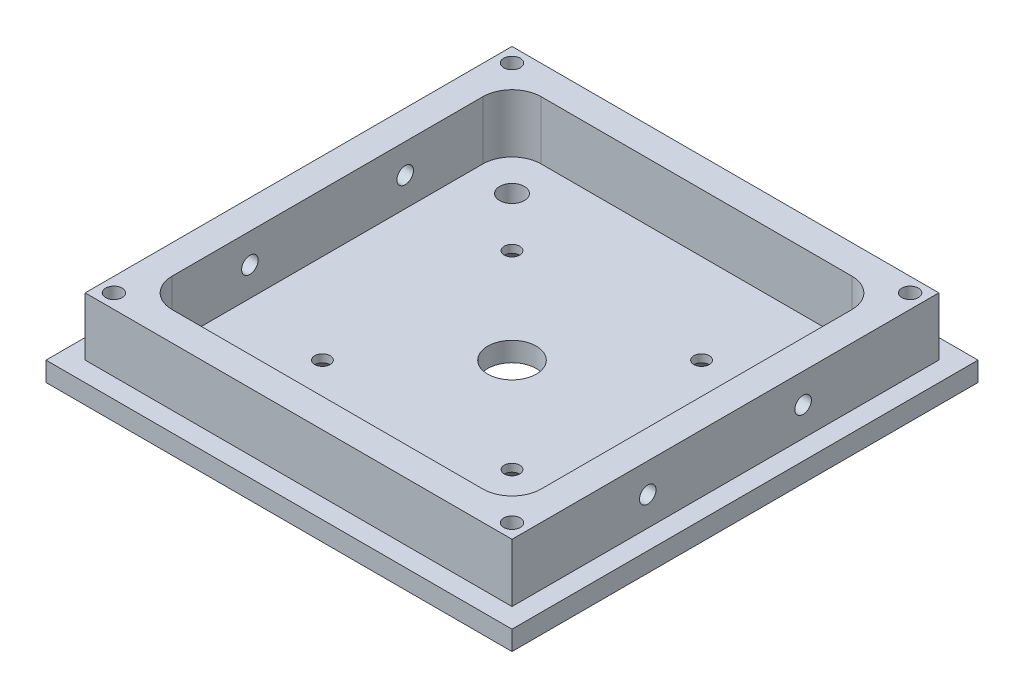
from build123d import *
from OCP.BRepFilletAPI import BRepFilletAPI_MakeChamfer

# Parameters (mm, degrees)
SKETCH1_W                    = 76.2
SKETCH1_H                    = 76.2
BOSS_EXTRUDE1_DEPTH          = 3.175
SKETCH2_W                    = 69.79412
SKETCH2_H                    = 69.79412
SKETCH2_W_2                  = 60.325
SKETCH2_H_2                  = 60.325
BOSS_EXTRUDE2_DEPTH          = 9.525
FILLET1_R                    = 4.7625
F_39_0_0995_DIAMETER_HOLE1_D = 2.5273
F_10_32_TAPPED_HOLE1_D       = 4.0386
CHAMFER1_SIZE                = 1.905
CHAMFER1_SIZE2               = 1.655991236
F_6_32_TAPPED_HOLE1_D        = 2.7051
SKETCH3_R                    = 3.96875
CUT_EXTRUDE1_DEPTH           = 55.716959208
CIRPATTERN1_COUNT            = 4


with BuildPart() as part:
    # Sketch1 → Boss-Extrude1 (new body)
    with BuildSketch(Plane(origin=(0, 0, 0), x_dir=(1, 0, 0), z_dir=(0, 1, 0))):
        Rectangle(SKETCH1_W, SKETCH1_H)
    extrude(amount=BOSS_EXTRUDE1_DEPTH)

    # Sketch2 → Boss-Extrude2 (add)
    with BuildSketch(Plane(origin=(0, 3.175, 0), x_dir=(1, 0, 0), z_dir=(0, 1, 0))):
        Rectangle(SKETCH2_W, SKETCH2_H)
        Rectangle(SKETCH2_W_2, SKETCH2_H_2, mode=Mode.SUBTRACT)
    extrude(amount=BOSS_EXTRUDE2_DEPTH)

    # Fillet1
    fillet1_edges = [part.edges().sort_by_distance(p)[0] for p in [
        (-30.1625, 7.9375, 30.1625),
        (30.1625, 7.9375, 30.1625),
        (30.1625, 7.9375, -30.1625),
        (-30.1625, 7.9375, -30.1625),
    ]]
    fillet(fillet1_edges, radius=FILLET1_R)

    # #39 (0.0995) Diameter Hole1 (through all)
    with Locations(Plane(origin=(0, 3.175, 0), x_dir=(1, 0, 0), z_dir=(0, 1, 0))):
        with Locations((15.5, 15.5), (-15.5, 15.5), (-15.5, -15.5), (15.5, -15.5), (-23.5966, 23.5966), (23.5966, 23.5966), (23.5966, -23.5966), (-23.5966, -23.5966)):
            Hole(F_39_0_0995_DIAMETER_HOLE1_D / 2)

    # #10-32 Tapped Hole1 (through all)
    with Locations(Plane(origin=(0, 3.175, 0), x_dir=(1, 0, 0), z_dir=(0, 1, 0))):
        with Locations((-23.5966, 23.5966), (23.5966, 23.5966), (23.5966, -23.5966), (-23.5966, -23.5966)):
            Hole(F_10_32_TAPPED_HOLE1_D / 2)

    # Sketch9 → #6-32 Tapped Hole2 (revolve, cut)
    with BuildSketch(Plane(origin=(34.89706, 7.9375, 12.7), x_dir=(0, 0, -1), z_dir=(0, 1, 0))):
        Polygon((0, 0), (0, 11.98869403), (1.35255, 11.176), (1.35255, 0), align=None)
    f_6_32_tapped_hole2 = revolve(axis=Axis((41.24706, 7.9375, 12.7), (-1, 0, 0)), mode=Mode.SUBTRACT)

    # Mirror1: #6-32 Tapped Hole2 across plane
    add(f_6_32_tapped_hole2.mirror(Plane.XY), mode=Mode.SUBTRACT)

    # Mirror2 copy 1 sketch → Mirror2 copy 1 (revolve, cut)
    with BuildSketch(Plane(origin=(-34.89706, 7.9375, -12.7), x_dir=(0, 0, 1), z_dir=(0, 1, 0))):
        Polygon((0, 0), (0, 11.98869403), (1.35255, 11.176), (1.35255, 0), align=None)
    revolve(axis=Axis((-41.24706, 7.9375, -12.7), (1, 0, 0)), mode=Mode.SUBTRACT)

    # Mirror2 copy 2 sketch → Mirror2 copy 2 (revolve, cut)
    with BuildSketch(Plane(origin=(-34.89706, 7.9375, 12.7), x_dir=(0, 0, -1), z_dir=(0, 1, 0))):
        Polygon((0, 0), (0, -11.98869403), (1.35255, -11.176), (1.35255, 0), align=None)
    revolve(axis=Axis((-41.24706, 7.9375, 12.7), (-1, 0, 0)), mode=Mode.SUBTRACT)

    # Chamfer1: one chamfer whose edges measure the first distance from different faces: ONE call of the kernel's chamfer builder (chamfer() names one face for all edges)
    chamfer1_edges_1 = [part.edges().sort_by_distance(p)[0] for p in [
        (-14.23635, 0, -15.5),
    ]]
    chamfer1_side_1 = [part.faces().sort_by_distance(p)[0] for p in [
        (-14.23635, 1.5875, -15.5),
    ]]
    chamfer1_edges_2 = [part.edges().sort_by_distance(p)[0] for p in [
        (16.76365, 0, -15.5),
    ]]
    chamfer1_side_2 = [part.faces().sort_by_distance(p)[0] for p in [
        (16.76365, 1.5875, -15.5),
    ]]
    chamfer1_edges_3 = [part.edges().sort_by_distance(p)[0] for p in [
        (16.76365, 0, 15.5),
    ]]
    chamfer1_side_3 = [part.faces().sort_by_distance(p)[0] for p in [
        (16.76365, 1.5875, 15.5),
    ]]
    chamfer1_edges_4 = [part.edges().sort_by_distance(p)[0] for p in [
        (-14.23635, 0, 15.5),
    ]]
    chamfer1_side_4 = [part.faces().sort_by_distance(p)[0] for p in [
        (-14.23635, 1.5875, 15.5),
    ]]
    chamfer1 = BRepFilletAPI_MakeChamfer(part.part.solid().wrapped)
    for e in chamfer1_edges_1:
        chamfer1.Add(CHAMFER1_SIZE, CHAMFER1_SIZE2, e.wrapped, chamfer1_side_1[0].wrapped)  # the first distance lies on this face
    for e in chamfer1_edges_2:
        chamfer1.Add(CHAMFER1_SIZE, CHAMFER1_SIZE2, e.wrapped, chamfer1_side_2[0].wrapped)  # the first distance lies on this face
    for e in chamfer1_edges_3:
        chamfer1.Add(CHAMFER1_SIZE, CHAMFER1_SIZE2, e.wrapped, chamfer1_side_3[0].wrapped)  # the first distance lies on this face
    for e in chamfer1_edges_4:
        chamfer1.Add(CHAMFER1_SIZE, CHAMFER1_SIZE2, e.wrapped, chamfer1_side_4[0].wrapped)  # the first distance lies on this face
    add(Compound.cast(chamfer1.Shape()), mode=Mode.REPLACE)

    # #6-32 Tapped Hole1 (through all)
    with Locations(Plane(origin=(0, 0, 0), x_dir=(-1, 0, 0), z_dir=(0, -1, 0))):
        with Locations((-32.5501, 32.5501)):
            f_6_32_tapped_hole1 = Hole(F_6_32_TAPPED_HOLE1_D / 2)

    # Sketch3 → Cut-Extrude1 (cut, through all)
    with BuildSketch(Plane(origin=(0, 3.175, 0), x_dir=(1, 0, 0), z_dir=(0, 1, 0))):
        Circle(SKETCH3_R)
    extrude(amount=-CUT_EXTRUDE1_DEPTH, mode=Mode.SUBTRACT)

    # CirPattern1: #6-32 Tapped Hole1 ×4 about axis
    cirpattern1_axis = Axis((0, 0, 0), (0, 1, 0))
    for i in range(1, CIRPATTERN1_COUNT):
        add(f_6_32_tapped_hole1.rotate(cirpattern1_axis, i * 360 / CIRPATTERN1_COUNT), mode=Mode.SUBTRACT)


solid = part.part
